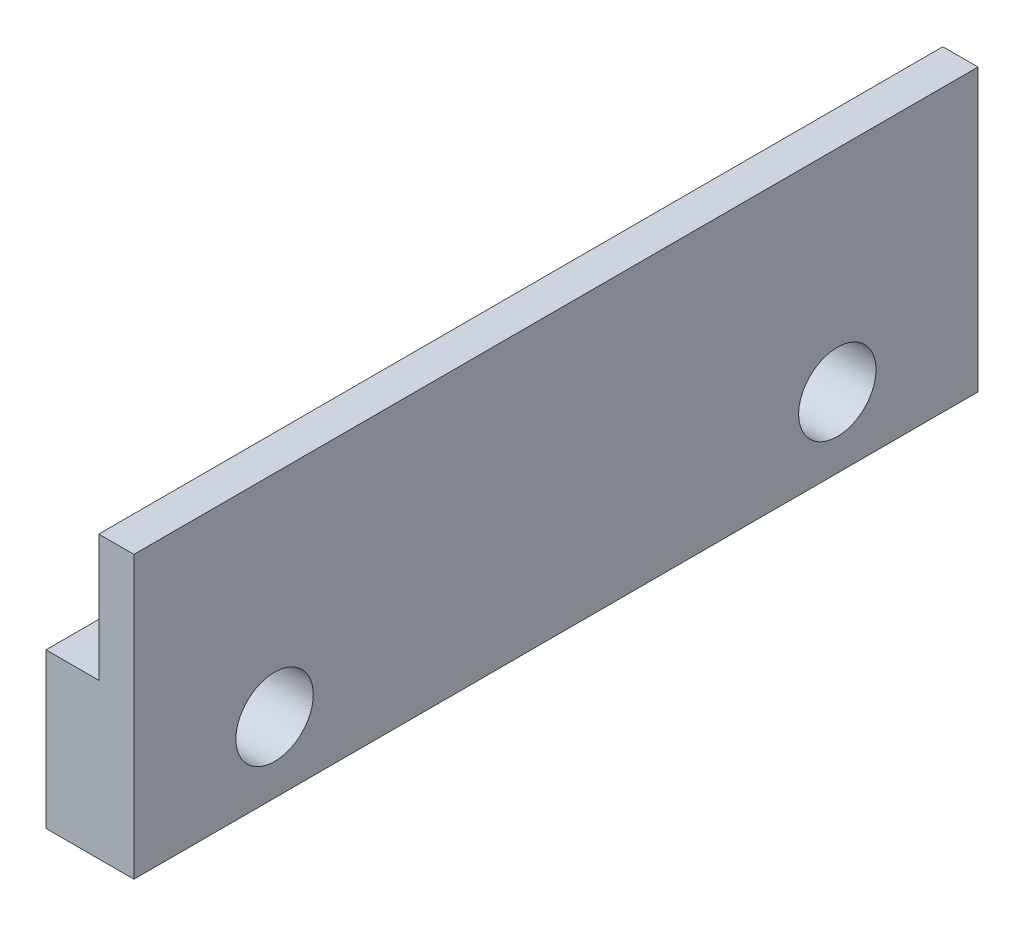
from build123d import *

# Parameters (mm, degrees)
BOSS_EXTRUDE1_DEPTH = 152.4
SKETCH2_R           = 6.985
CUT_EXTRUDE1_DEPTH  = 15.875


with BuildPart() as part:
    # Sketch1 → Boss-Extrude1 (new body)
    with BuildSketch(Plane.XY):
        Polygon((0, 17.2640625), (0, -5.5959375), (-9.525, -5.5959375), (-9.525, -33.5359375), (6.35, -33.5359375), (6.35, 17.2640625), align=None)
    extrude(amount=BOSS_EXTRUDE1_DEPTH)

    # Sketch2 → Cut-Extrude1 (cut)
    with BuildSketch(Plane(origin=(6.35, 0, 0), x_dir=(0, 0, -1), z_dir=(1, 0, 0))):
        with Locations((-127, -20.8359375)):
            Circle(SKETCH2_R)
        with Locations((-25.4, -20.8359375)):
            Circle(SKETCH2_R)
    extrude(amount=-CUT_EXTRUDE1_DEPTH, mode=Mode.SUBTRACT)


solid = part.part
